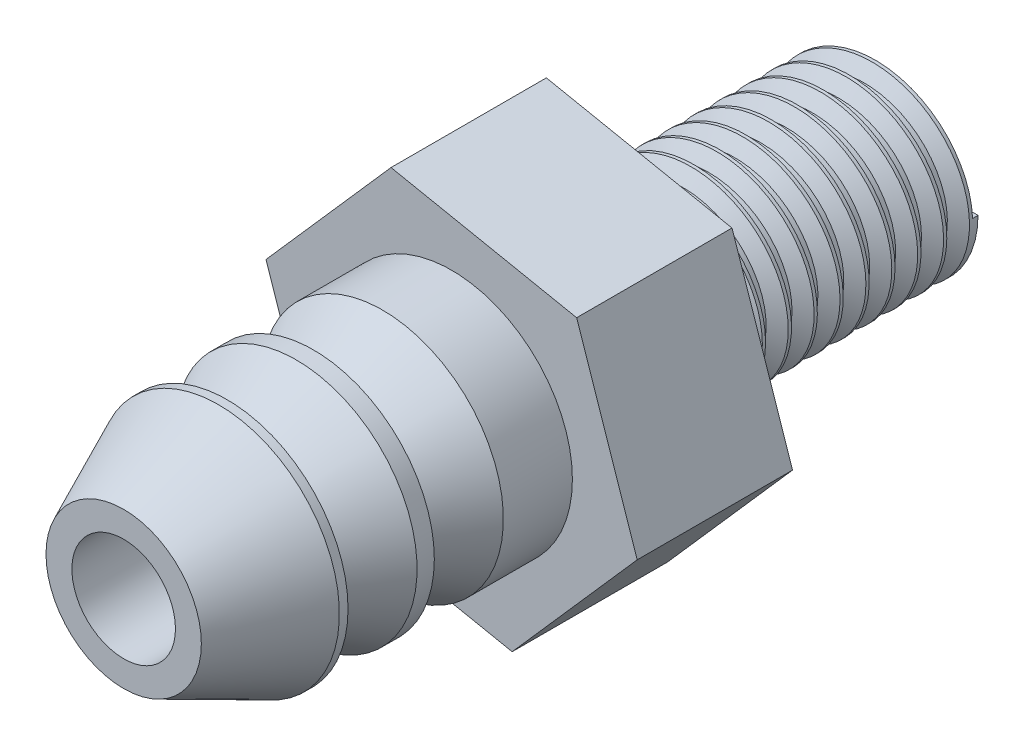
from build123d import *

# Parameters (mm, degrees)
SKETCH_1_R          = 5.5
EXTRUDE_1_DEPTH     = 17
EXTRUDE_2_DEPTH     = 9
SKETCH_3_R          = 7
EXTRUDE_4_DEPTH     = 4
SKETCH_6_R          = 7
EXTRUDE_5_DEPTH     = 1
SKETCH_7_R          = 7
EXTRUDE_6_DEPTH     = 0.5
THREAD_1_PITCH      = 1.5
SKETCH_15_R         = 5.5
CUT_EXTRUDE_1_DEPTH = 1
CUT_EXTRUDE_START   = 1.5
SKETCH_16_R         = 5.5
SKETCH_16_R_2       = 4.632906692
CUT_EXTRUDE_2_DEPTH = 1.5
SKETCH_17_R         = 7.853431635
EXTRUDE_10_DEPTH    = 1.5
SKETCH_8_R          = 3
CUT_EXTRUDE_3_DEPTH = 47.472519073


# Read off the part's stored shape, not the designer's step: По сечениям1, По сечениям2, По сечениям3
with BuildPart() as part:
    # Sketch 1 → Бобышка-Вытянуть1 (new body)
    with BuildSketch(Plane.XY):
        Circle(SKETCH_1_R)
    extrude(amount=EXTRUDE_1_DEPTH)

    # Эскиз2 → Бобышка-Вытянуть2 (add)
    with BuildSketch(Plane.XY.offset(17)):
        Polygon((7.245520856, 8.23624677), (-3.510038507, 10.39292851), (-10.755559363, 2.15668174), (-7.245520856, -8.23624677), (3.510038507, -10.39292851), (10.755559363, -2.15668174), align=None)
    extrude(amount=EXTRUDE_2_DEPTH)

    # Эскиз3 → Бобышка-Вытянуть4 (add)
    with BuildSketch(Plane.XY.offset(26)):
        Circle(SKETCH_3_R)
    extrude(amount=EXTRUDE_4_DEPTH)

    # По сечениям1 outline → По сечениям1 (revolve)
    with BuildSketch(Plane.XZ):
        Polygon((4.5, 34), (0, 34), (0, 30), (7, 30), align=None)
    revolve(axis=Axis((0, 0, 0), (0, 0, 1)))

    # Эскиз6 → Бобышка-Вытянуть5 (add)
    with BuildSketch(Plane.XY.offset(34)):
        with Locations(Location((0, 0, 0), (0, 0, 180))):
            Circle(SKETCH_6_R)
    extrude(amount=EXTRUDE_5_DEPTH)

    # По сечениям2 outline → По сечениям2 (revolve)
    with BuildSketch(Plane.XZ):
        Polygon((4.48267593, 39), (0, 39), (0, 35), (7, 35), align=None)
    revolve(axis=Axis((0, 0, 0), (0, 0, 1)))

    # Эскиз7 → Бобышка-Вытянуть6 (add)
    with BuildSketch(Plane.XY.offset(39)):
        with Locations(Location((0, 0, 0), (0, 0, 180))):
            Circle(SKETCH_7_R)
    extrude(amount=EXTRUDE_6_DEPTH)

    # По сечениям3 outline → По сечениям3 (revolve)
    with BuildSketch(Plane.XZ):
        Polygon((4.5, 45), (0, 45), (0, 39.5), (7, 39.5), align=None)
    revolve(axis=Axis((0, 0, 0), (0, 0, 1)))

    # Резьба1: the profile of Sketch 1 2 profile screwed along a right-hand helix of 11.333333 turns, 8 arcs to a turn; built about Z, then put on its axis
    thread_1_z = Axis((0, 0, 0), (0, 0, 1))
    thread_1_corners = [(5.5003, 0, -0.000173205), (5.5003, 0, 1.312673201), (4.688101188, 0, 0.843749998), (4.688101188, 0, 0.468749998)]
    with BuildLine(mode=Mode.PRIVATE) as thread_1_profile:
        Line(thread_1_corners[0], thread_1_corners[1])
        Line(thread_1_corners[1], thread_1_corners[2])
        Line(thread_1_corners[2], thread_1_corners[3])
        Line(thread_1_corners[3], thread_1_corners[0])
    thread_1_cap = Face(thread_1_profile.wire())
    thread_1_turn_angles = [0, 22.5, 45, 67.5, 90, 112.5, 135, 157.5, 180, 202.5, 225, 247.5, 270, 292.5, 315, 337.5, 360]
    thread_1_turn_weights = [1, 0.9238795325112867, 1, 0.9238795325112867, 1, 0.9238795325112867, 1, 0.9238795325112867, 1, 0.9238795325112867, 1, 0.9238795325112867, 1, 0.9238795325112867, 1, 0.9238795325112867, 1]
    thread_1_turn_rails = [Edge.make_bspline([Vector(p[0], p[1], 0).rotate(thread_1_z, thread_1_turn_angles[k]) / thread_1_turn_weights[k] + Vector(0, 0, p[2] + THREAD_1_PITCH * thread_1_turn_angles[k] / 360) for k in range(17)], [0, 0, 0, 1, 1, 2, 2, 3, 3, 4, 4, 5, 5, 6, 6, 7, 7, 8, 8, 8], 2, thread_1_turn_weights) for p in thread_1_corners]
    thread_1_turn_sides = [Face.make_surface_from_curves(thread_1_turn_rails[p[0]], thread_1_turn_rails[p[1]]) for p in [(0, 1), (1, 2), (2, 3), (3, 0)]]
    thread_1_last_angles = [3960, 3982.5, 4005, 4027.5, 4050, 4065, 4080]
    thread_1_last_weights = [1, 0.9238795325112867, 1, 0.9238795325112867, 1, 0.9659258262890693, 1]
    thread_1_last_rails = [Edge.make_bspline([Vector(p[0], p[1], 0).rotate(thread_1_z, thread_1_last_angles[k]) / thread_1_last_weights[k] + Vector(0, 0, p[2] + THREAD_1_PITCH * thread_1_last_angles[k] / 360) for k in range(7)], [0, 0, 0, 1, 1, 2, 2, 3, 3, 3], 2, thread_1_last_weights) for p in thread_1_corners]
    thread_1_last_sides = [Face.make_surface_from_curves(thread_1_last_rails[p[0]], thread_1_last_rails[p[1]]) for p in [(0, 1), (1, 2), (2, 3), (3, 0)]]
    thread_1 = Plane(origin=(0, 0, 0), x_dir=(1, 0, 0), z_dir=(0, 0, 1)) * Solid(Shell([*[p.moved(Location((0, 0, THREAD_1_PITCH * i))) for i in range(11) for p in thread_1_turn_sides], *thread_1_last_sides, thread_1_cap, thread_1_cap.rotate(thread_1_z, 4080).moved(Location((0, 0, THREAD_1_PITCH * 4080 / 360)))]))
    add(thread_1, mode=Mode.SUBTRACT)

    # Эскиз15 → Вырез-Вытянуть1 (cut)
    with BuildSketch(Plane(origin=(0, 0, 0), x_dir=(-1, 0, 0), z_dir=(0, 0, -1))):
        Circle(SKETCH_15_R)
    extrude(amount=-CUT_EXTRUDE_1_DEPTH, mode=Mode.SUBTRACT)

    # Эскиз16 → Вырез-Вытянуть2 (cut)
    with BuildSketch(Plane(origin=(0, 0, 17), x_dir=(-1, 0, 0), z_dir=(0, 0, -1)).offset(CUT_EXTRUDE_START)):
        Circle(SKETCH_16_R)
        Circle(SKETCH_16_R_2, mode=Mode.SUBTRACT)
    extrude(amount=-CUT_EXTRUDE_2_DEPTH, mode=Mode.SUBTRACT)

    # Эскиз17 → Бобышка-Вытянуть10 (add)
    with BuildSketch(Plane(origin=(0, 0, 17), x_dir=(-1, 0, 0), z_dir=(0, 0, -1))):
        Circle(SKETCH_17_R)
    extrude(amount=-EXTRUDE_10_DEPTH)

    # Эскиз8 → Вырез-Вытянуть3 (cut, through all)
    with BuildSketch(Plane.XY.offset(45)):
        Circle(SKETCH_8_R)
    extrude(amount=-CUT_EXTRUDE_3_DEPTH, mode=Mode.SUBTRACT)


solid = part.part
